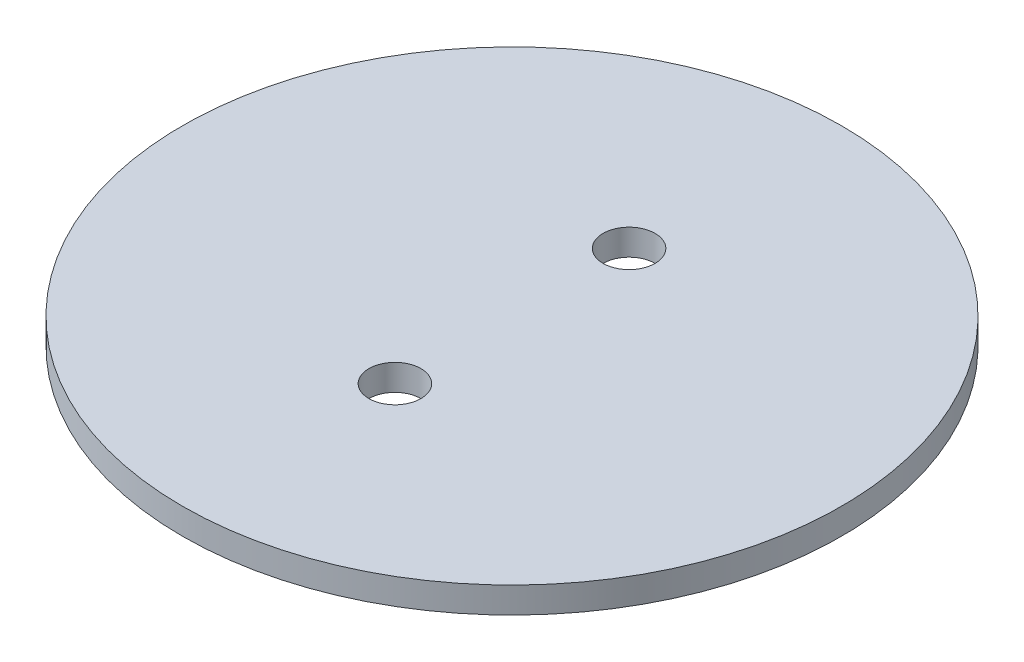
from build123d import *

# Parameters (mm, degrees)
SKETCH1_R           = 38
BOSS_EXTRUDE1_DEPTH = 3


with BuildPart() as part:
    # Sketch1 → Boss-Extrude1 (new body)
    with BuildSketch(Plane(origin=(0, 0, 0), x_dir=(1, 0, 0), z_dir=(0, 1, 0))):
        Circle(SKETCH1_R)
        with BuildLine():
            ThreePointArc((3, -13.5), (-2.121320344, -15.621320344), (0, -10.5))
            ThreePointArc((0, -10.5), (2.121320344, -11.378679656), (3, -13.5))
        make_face(mode=Mode.SUBTRACT)
        with BuildLine():
            ThreePointArc((3, 13.5), (2.121320344, 11.378679656), (0, 10.5))
            ThreePointArc((0, 10.5), (-2.121320344, 15.621320344), (3, 13.5))
        make_face(mode=Mode.SUBTRACT)
    extrude(amount=-BOSS_EXTRUDE1_DEPTH)


solid = part.part
